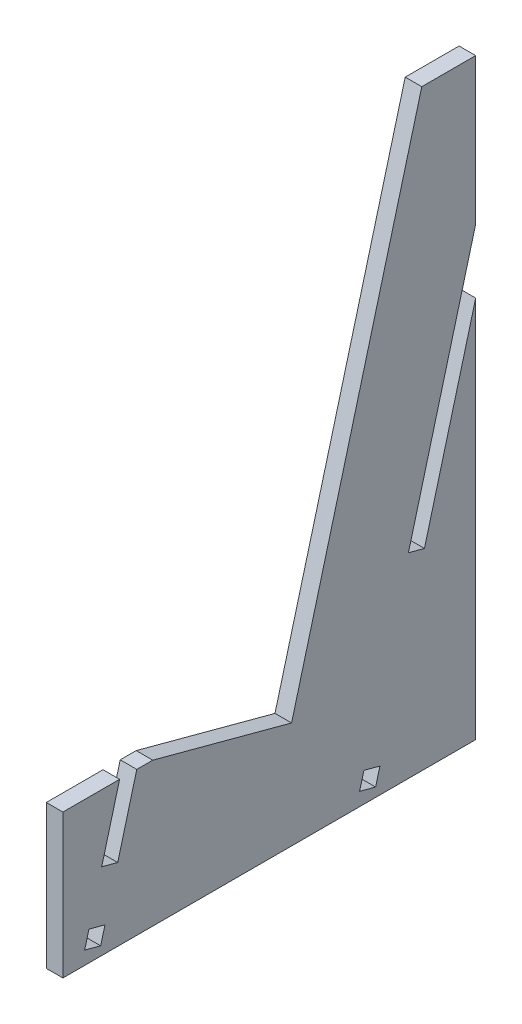
from build123d import *

# Parameters (mm, degrees)
BOSS_EXTRUDE1_DEPTH = 2.929999982
CUT_EXTRUDE4_DEPTH  = 128.635276199
CUT_EXTRUDE6_DEPTH  = 128.635276199
CUT_EXTRUDE7_DEPTH  = 128.635276199
CUT_EXTRUDE9_DEPTH  = 128.635276199


with BuildPart() as part:
    # Sketch1 → Boss-Extrude1 (new body)
    with BuildSketch(Plane(origin=(0, 0, 0), x_dir=(0, 0, -1), z_dir=(1, 0, 0))):
        Polygon((0, 0), (0, 104.696802211), (-9.525, 104.696802211), (-32.53401311, 18.825996254), (-57.068529097, 25.4), (-72.943529097, 25.4), (-72.943529097, 0), align=None)
    extrude(amount=BOSS_EXTRUDE1_DEPTH)

    # Sketch5 → Cut-Extrude4 (cut, through all)
    with BuildSketch(Plane(origin=(2.929999982, 0, 0), x_dir=(0, 0, -1), z_dir=(1, 0, 0))):
        Polygon((0, 67.58764557), (0, 78.908296184), (-11.885190178, 34.552162582), (-9.055027524, 33.793822785), align=None)
    extrude(amount=-CUT_EXTRUDE4_DEPTH, mode=Mode.SUBTRACT)

    # Sketch7 → Cut-Extrude6 (cut, through all)
    with BuildSketch(Plane.ZY):
        Polygon((63.256615243, 12.832490583), (66.086777897, 13.590830381), (62.719323898, 26.158339797), (59.889161244, 25.4), align=None)
    extrude(amount=-CUT_EXTRUDE6_DEPTH, mode=Mode.SUBTRACT)

    # Sketch9 → Cut-Extrude7 (cut, through all)
    with BuildSketch(Plane.ZY):
        Polygon((65.511361591, 4.417662654), (66.269701389, 1.5875), (69.099864042, 2.345839797), (68.341524245, 5.176002451), align=None)
    extrude(amount=-CUT_EXTRUDE7_DEPTH, mode=Mode.SUBTRACT)

    # Sketch11 → Cut-Extrude9 (cut, through all)
    with BuildSketch(Plane.ZY):
        Polygon((17.68340744, 1.592270551), (20.513570094, 2.350610348), (19.755230297, 5.180773002), (16.925067643, 4.422433205), align=None)
    extrude(amount=-CUT_EXTRUDE9_DEPTH, mode=Mode.SUBTRACT)


solid = part.part
